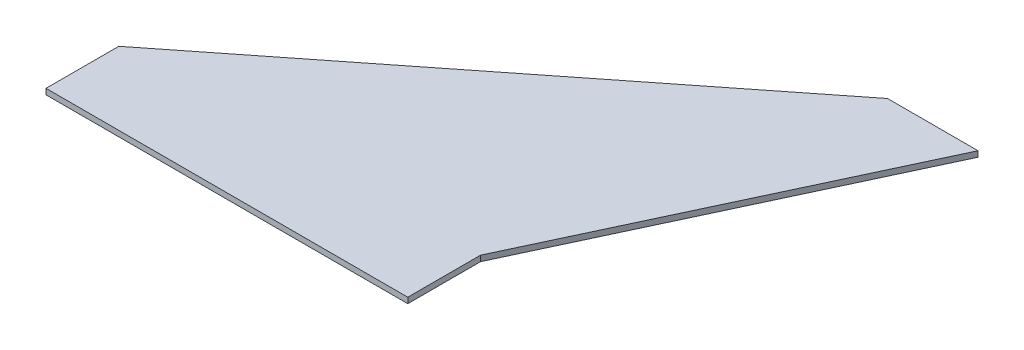
from build123d import *

# Parameters (mm, degrees)
BOSS_EXTRUDE1_DEPTH = 3.175


with BuildPart() as part:
    # Sketch1 → Boss-Extrude1 (new body)
    with BuildSketch(Plane(origin=(0, 0, 0), x_dir=(1, 0, 0), z_dir=(0, 1, 0))):
        Polygon((241.3, 231.394), (0, 40.894), (0, 0), (203.2, 0), (203.2, 40.894), (292.1, 231.394), align=None)
    extrude(amount=BOSS_EXTRUDE1_DEPTH)


solid = part.part
